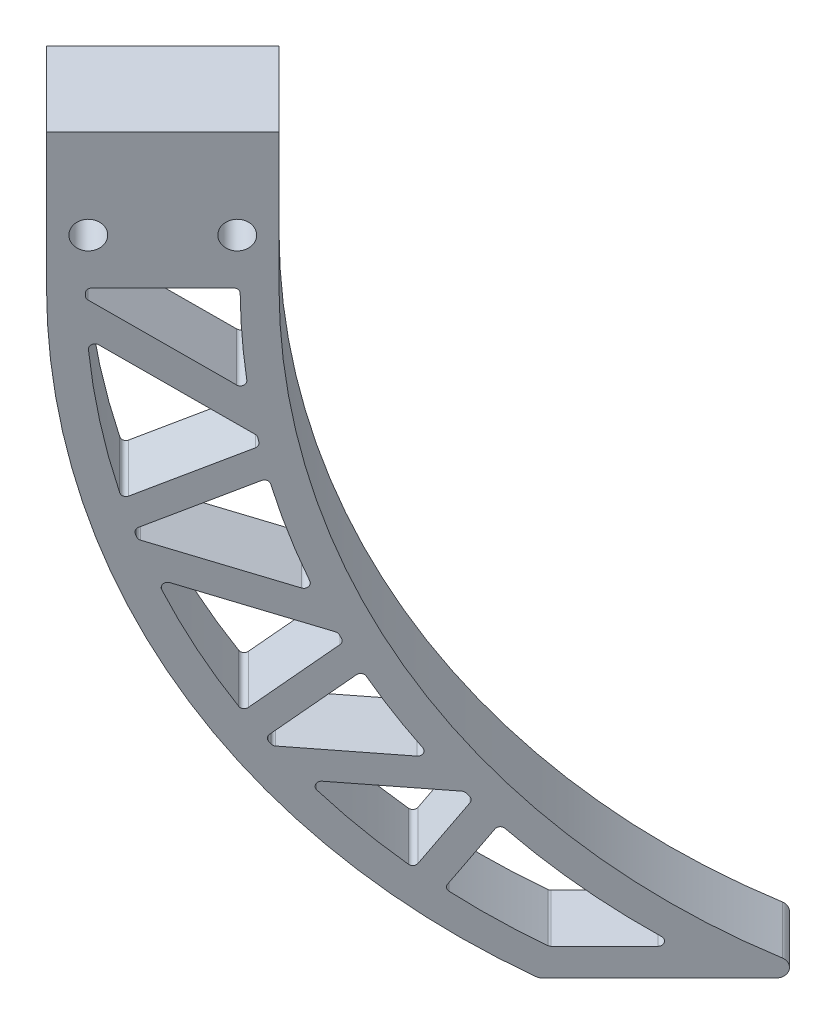
from build123d import *

# Parameters (mm, degrees)
BOSS_EXTRUDE1_DEPTH      = 40
BOSS_EXTRUDE1_DEPTH_BACK = 40
CUT_EXTRUDE1_DEPTH       = 30
CUT_EXTRUDE1_DEPTH_BACK  = 207.92123274
SKETCH3_R                = 1.5
CUT_EXTRUDE2_DEPTH       = 206.675682312
FILLET1_R                = 1
CUT_EXTRUDE3_DEPTH       = 40
FILLET2_R                = 0.5


with BuildPart() as part:
    # Sketch1 → Boss-Extrude1 (new, two sides: drawn at the far end of the back side and taken through both)
    with BuildSketch(Plane(origin=(61.148873397, 0, -61.148873397), x_dir=(0.7071067811865499, 0, 0.7071067811865452), z_dir=(-0.7071067811865452, 0, 0.7071067811865499)).offset(-BOSS_EXTRUDE1_DEPTH_BACK)):
        Polygon((-3.75, -92.901515315), (-3.75, -84.066578824), (-7.75, -81.757177748), (-7.75, -79.151515315), (3.75, -79.151515315), (3.75, -92.901515315), (3.75, -159.151515315), (-3.75, -159.151515315), align=None)
    extrude(amount=BOSS_EXTRUDE1_DEPTH + BOSS_EXTRUDE1_DEPTH_BACK)

    # Sketch2 → Cut-Extrude1 (cut, two sides: drawn at the far end of the back side and taken through both)
    with BuildSketch(Plane(origin=(-2.651650429, 0, -2.651650429), x_dir=(-0.7071067811865454, 0, 0.7071067811865498), z_dir=(-0.7071067811865498, 0, -0.7071067811865454)).offset(-CUT_EXTRUDE1_DEPTH_BACK)):
        with BuildLine():
            Line((-83.584702548, -79.151515315), (-83.584702548, -93.901515315))
            ThreePointArc((-83.584702548, -93.901515315), (-95.268174411, -132.944313121), (-126.477566081, -159.151515315))
            Line((-126.477566081, -159.151515315), (-126.477566081, -79.151515315))
            Line((-126.477566081, -79.151515315), (-83.584702548, -79.151515315))
        make_face()
        with BuildLine():
            Line((-65.634702548, -93.901515315), (-65.634702548, -79.151515315))
            Line((-65.634702548, -79.151515315), (-46.477566081, -79.151515315))
            Line((-46.477566081, -79.151515315), (-46.477566081, -159.151515315))
            Line((-46.477566081, -159.151515315), (-103.655823441, -159.151515315))
            ThreePointArc((-103.655823441, -159.151515315), (-75.833406523, -131.661176774), (-65.634702548, -93.901515315))
        make_face()
    extrude(amount=CUT_EXTRUDE1_DEPTH + CUT_EXTRUDE1_DEPTH_BACK, mode=Mode.SUBTRACT)

    # Sketch3 → Cut-Extrude2 (cut, through all)
    with BuildSketch(Plane(origin=(2.651650429, 0, 2.651650429), x_dir=(0.7071067811865454, 0, -0.7071067811865498), z_dir=(0.7071067811865498, 0, 0.7071067811865454))):
        with Locations((68.859702548, -88.901515315)):
            Circle(SKETCH3_R)
        with Locations((80.359702548, -88.901515315)):
            Circle(SKETCH3_R)
    extrude(amount=-CUT_EXTRUDE2_DEPTH, mode=Mode.SUBTRACT)

    # Fillet1
    fillet1_edges = [part.edges().sort_by_distance(p)[0] for p in [
        (73.295735665, -159.151515315, -73.295735665),
        (89.433144644, -159.151515315, -89.433144644),
    ]]
    fillet(fillet1_edges, radius=FILLET1_R)

    # Sketch4 → Cut-Extrude3 (cut)
    with BuildSketch(Plane(origin=(-2.651650429, 0, -2.651650429), x_dir=(-0.7071067811865454, 0, 0.7071067811865498), z_dir=(-0.7071067811865498, 0, -0.7071067811865454))):
        with BuildLine():
            ThreePointArc((-68.641647327, -94.901515315), (-68.636438764, -94.401527372), (-68.634702548, -93.901515315))
            Line((-68.634702548, -93.901515315), (-80.584702548, -93.901515315))
            ThreePointArc((-80.584702548, -93.901515315), (-80.748343747, -98.822606959), (-81.238542868, -103.721956531))
            Line((-81.238542868, -103.721956531), (-68.641647327, -94.901515315))
        make_face()
        with BuildLine():
            ThreePointArc((-71.446777789, -113.827153762), (-69.713665767, -106.319507983), (-68.79275862, -98.669648347))
            Line((-68.79275862, -98.669648347), (-81.910741312, -107.854958715))
            ThreePointArc((-81.910741312, -107.854958715), (-82.008492364, -108.355301003), (-82.109684478, -108.854958715))
            Line((-82.109684478, -108.854958715), (-71.446777789, -113.827153762))
        make_face()
        with BuildLine():
            ThreePointArc((-72.669081723, -117.664393631), (-72.505700586, -117.19183716), (-72.34560503, -116.718157493))
            Line((-72.34560503, -116.718157493), (-82.791324081, -111.847238704))
            ThreePointArc((-82.791324081, -111.847238704), (-84.384922058, -117.323155489), (-86.395070265, -122.660244896))
            Line((-86.395070265, -122.660244896), (-72.669081723, -117.664393631))
        make_face()
        with BuildLine():
            ThreePointArc((-80.784042437, -133.925239334), (-77.121371127, -127.814001685), (-74.080630429, -121.370688662))
            Line((-74.080630429, -121.370688662), (-88.136449193, -126.48658831))
            ThreePointArc((-88.136449193, -126.48658831), (-88.357906284, -126.934873492), (-88.582384151, -127.381653678))
            Line((-88.582384151, -127.381653678), (-80.784042437, -133.925239334))
        make_face()
        with BuildLine():
            ThreePointArc((-83.105887337, -137.19626581), (-82.806616537, -136.795716185), (-82.510134547, -136.393097949))
            Line((-82.510134547, -136.393097949), (-90.024605255, -130.087708349))
            ThreePointArc((-90.024605255, -130.087708349), (-92.547245897, -134.264707863), (-95.339415884, -138.266560873))
            Line((-95.339415884, -138.266560873), (-83.105887337, -137.19626581))
        make_face()
        with BuildLine():
            ThreePointArc((-94.002421329, -148.759790428), (-89.676742116, -144.76688928), (-85.691714117, -140.433955852))
            Line((-85.691714117, -140.433955852), (-97.902966063, -141.502301965))
            ThreePointArc((-97.902966063, -141.502301965), (-98.225553246, -141.884323374), (-98.550711636, -142.264158692))
            Line((-98.550711636, -142.264158692), (-94.002421329, -148.759790428))
        make_face()
        with BuildLine():
            ThreePointArc((-104.455461262, -156.151515315), (-100.301370683, -153.543969496), (-96.334442354, -150.659659636))
            Line((-96.334442354, -150.659659636), (-100.609312238, -144.554512732))
            ThreePointArc((-100.609312238, -144.554512732), (-107.203125114, -150.779152155), (-114.508069897, -156.151515315))
            Line((-114.508069897, -156.151515315), (-104.455461262, -156.151515315))
        make_face()
    extrude(amount=-CUT_EXTRUDE3_DEPTH, mode=Mode.SUBTRACT)

    # Fillet2
    fillet2_edges = [part.edges().sort_by_distance(p)[0] for p in [
        (80.969432725, -156.151515315, -80.969432725),
        (71.141526934, -144.554512732, -71.141526934),
        (68.11873745, -150.659659636, -68.11873745),
        (73.86116499, -156.151515315, -73.86116499),
        (66.46974957, -148.759790428, -66.46974957),
        (60.593192144, -140.433955852, -60.593192144),
        (69.227851202, -141.502301965, -69.227851202),
        (69.685876488, -142.264158692, -69.685876488),
        (67.415147486, -138.266560873, -67.415147486),
        (63.65700885, -130.087708349, -63.65700885),
        (58.343475655, -136.393097949, -58.343475655),
        (58.764736493, -137.19626581, -58.764736493),
        (57.122944219, -133.925239334, -57.122944219),
        (52.382916131, -121.370688662, -52.382916131),
        (62.321880894, -126.48658831, -62.321880894),
        (62.637204527, -127.381653678, -62.637204527),
        (61.090540045, -122.660244896, -61.090540045),
        (58.542306681, -111.847238704, -58.542306681),
        (51.156067906, -116.718157493, -51.156067906),
        (51.384800469, -117.664393631, -51.384800469),
        (50.520501068, -113.827153762, -50.520501068),
        (48.643826116, -98.669648347, -48.643826116),
        (57.919640634, -107.854958715, -57.919640634),
        (58.060314695, -108.854958715, -58.060314695),
        (57.444324556, -103.721956531, -57.444324556),
        (56.981989631, -93.901515315, -56.981989631),
        (48.536974297, -94.901515315, -48.536974297),
        (48.532063596, -93.901515315, -48.532063596),
    ]]
    fillet(fillet2_edges, radius=FILLET2_R)


solid = part.part
